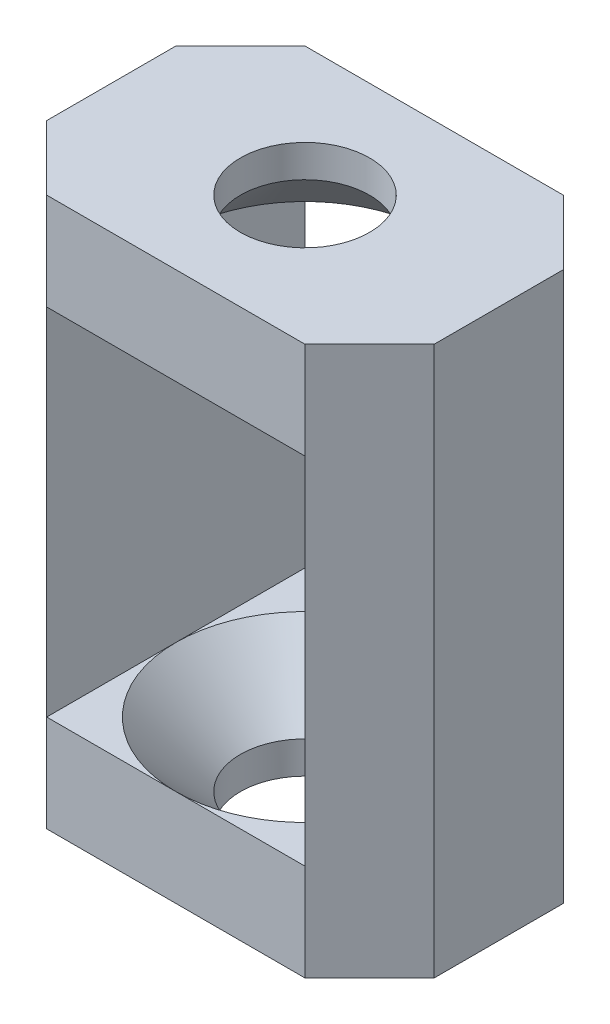
from build123d import *

# Parameters (mm, degrees)
SKETCH_1_W               = 12
SKETCH_1_H               = 8
EXTRUDE_1_DEPTH          = 17
CHAMFER_1_SIZE           = 2
SKETCH_3_W               = 8
SKETCH_3_H               = 11
CUT_EXTRUDE_1_DEPTH      = 84.5
CUT_EXTRUDE_2_DEPTH      = 19.466185313
CUT_EXTRUDE_2_DEPTH_BACK = 19.466185313
SKETCH_4_R               = 2
CHAMFER_2_SIZE           = 2


with BuildPart() as part:
    # 草图1 → 凸台-拉伸1 (new body)
    with BuildSketch(Plane(origin=(0, 0, 0), x_dir=(1, 0, 0), z_dir=(0, 1, 0))):
        Rectangle(SKETCH_1_W, SKETCH_1_H)
    extrude(amount=EXTRUDE_1_DEPTH)

    # 倒角1
    chamfer_1_edges = [part.edges().sort_by_distance(p)[0] for p in [
        (6, 8.5, 4),
        (-6, 8.5, 4),
        (-6, 8.5, -4),
        (6, 8.5, -4),
    ]]
    chamfer(chamfer_1_edges, length=CHAMFER_1_SIZE)

    # 草图3 → 切除-拉伸1 (cut, symmetric)
    with BuildSketch(Plane.XY.offset(4)):
        with Locations((0, 8.5)):
            Rectangle(SKETCH_3_W, SKETCH_3_H)
    extrude(amount=CUT_EXTRUDE_1_DEPTH, both=True, mode=Mode.SUBTRACT)

    # 草图4 → 切除-拉伸2 (cut, two sides: drawn at the far end of the back side and taken through both)
    with BuildSketch(Plane(origin=(0, 17, 0), x_dir=(1, 0, 0), z_dir=(0, 1, 0)).offset(-CUT_EXTRUDE_2_DEPTH_BACK)):
        with Locations(Location((0, 0, 0), (0, 0, 270))):
            Circle(SKETCH_4_R)
    extrude(amount=CUT_EXTRUDE_2_DEPTH + CUT_EXTRUDE_2_DEPTH_BACK, mode=Mode.SUBTRACT)

    # 倒角2
    chamfer_2_edges = [part.edges().sort_by_distance(p)[0] for p in [
        (0, 3, -2),
        (0, 14, -2),
    ]]
    chamfer(chamfer_2_edges, length=CHAMFER_2_SIZE - 0.0001)  # a hair under: the kernel refuses the full size


solid = part.part
